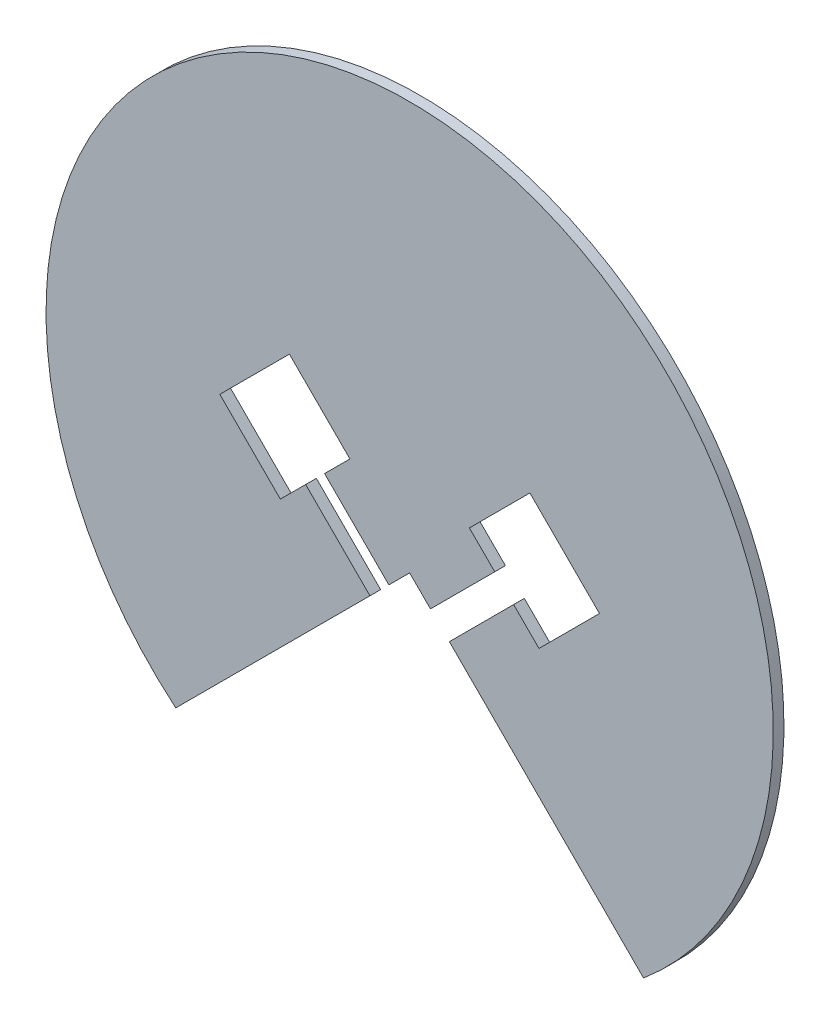
from build123d import *

# Parameters (mm, degrees)
SKETCH1_R           = 215.9
BOSS_EXTRUDE1_DEPTH = 6.35
CUT_EXTRUDE1_DEPTH  = 306.394732273
CUT_EXTRUDE2_DEPTH  = 306.394732273


with BuildPart() as part:
    # Sketch1 → Boss-Extrude1 (new body)
    with BuildSketch(Plane.XY):
        Circle(SKETCH1_R)
    extrude(amount=BOSS_EXTRUDE1_DEPTH)

    # Sketch2 → Cut-Extrude1 (cut, through all)
    with BuildSketch(Plane(origin=(0, 0, 0), x_dir=(-1, 0, 0), z_dir=(0, 0, -1))):
        with BuildLine():
            Line((0, -26.441092948), (138.870288723, -165.311381671))
            ThreePointArc((138.870288723, -165.311381671), (0, -215.9), (-138.870288723, -165.311381671))
            Line((-138.870288723, -165.311381671), (0, -26.441092948))
        make_face()
    extrude(amount=-CUT_EXTRUDE1_DEPTH, mode=Mode.SUBTRACT)

    # Sketch3 → Cut-Extrude2 (cut, through all)
    with BuildSketch(Plane.XY.offset(6.35)):
        Polygon((71.393036163, 50.340096887), (35.472011678, 14.419072403), (50.513940681, -0.6228566), (12.347852166, -38.788945114), (23.573172318, -50.014265265), (61.739260832, -11.848176751), (76.781189835, -26.890105754), (112.702214319, 9.030918731), align=None)
    cut_extrude2 = extrude(amount=-CUT_EXTRUDE2_DEPTH, mode=Mode.SUBTRACT)

    # Mirror1: Cut-Extrude2 across plane
    add(cut_extrude2.mirror(Plane(origin=(0, 0, 0), x_dir=(0, 0, 1), z_dir=(1, 0, 0))), mode=Mode.SUBTRACT)


solid = part.part
